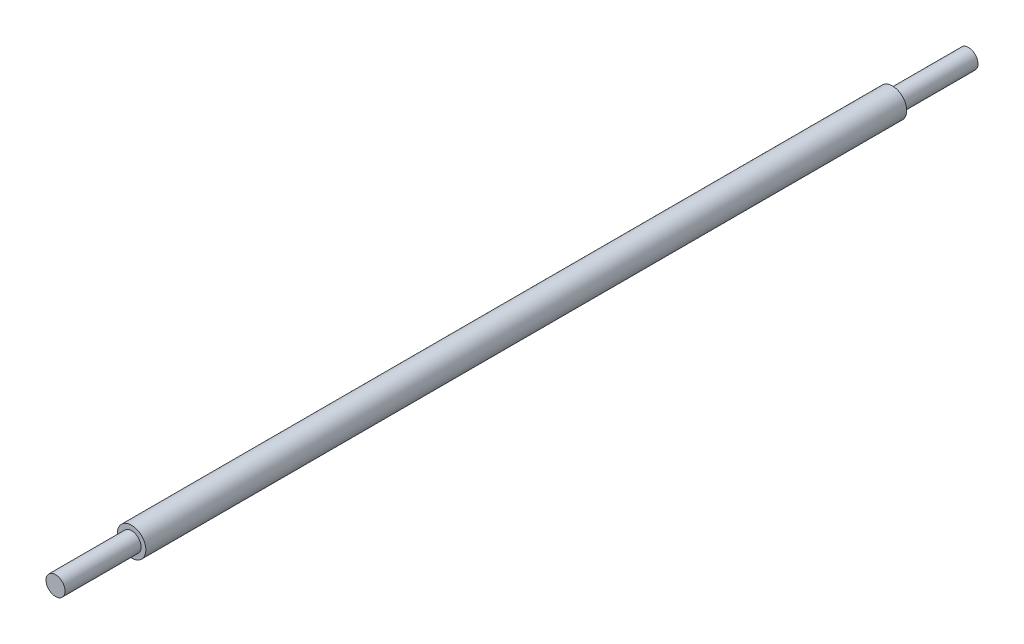
from build123d import *

# Parameters (mm, degrees)
SKETCH1_R           = 2.38125
BOSS_EXTRUDE1_DEPTH = 152.4
SKETCH2_R           = 2.38125
SKETCH2_R_2         = 1.5875
CUT_EXTRUDE1_DEPTH  = 12.7
CUT_EXTRUDE2_START  = -12.7
SKETCH3_R           = 2.38125
SKETCH3_R_2         = 1.5875
CUT_EXTRUDE2_DEPTH  = 12.7


with BuildPart() as part:
    # Sketch1 → Boss-Extrude1 (new body)
    with BuildSketch(Plane.XY):
        Circle(SKETCH1_R)
    extrude(amount=BOSS_EXTRUDE1_DEPTH)

    # Sketch2 → Cut-Extrude1 (cut)
    with BuildSketch(Plane(origin=(0, 0, 0), x_dir=(-1, 0, 0), z_dir=(0, 0, -1))):
        Circle(SKETCH2_R)
        Circle(SKETCH2_R_2, mode=Mode.SUBTRACT)
    extrude(amount=-CUT_EXTRUDE1_DEPTH, mode=Mode.SUBTRACT)

    # Sketch3 → Cut-Extrude2 (cut)
    with BuildSketch(Plane.XY.offset(152.4).offset(CUT_EXTRUDE2_START)):
        Circle(SKETCH3_R)
        Circle(SKETCH3_R_2, mode=Mode.SUBTRACT)
    extrude(amount=CUT_EXTRUDE2_DEPTH, mode=Mode.SUBTRACT)


solid = part.part
